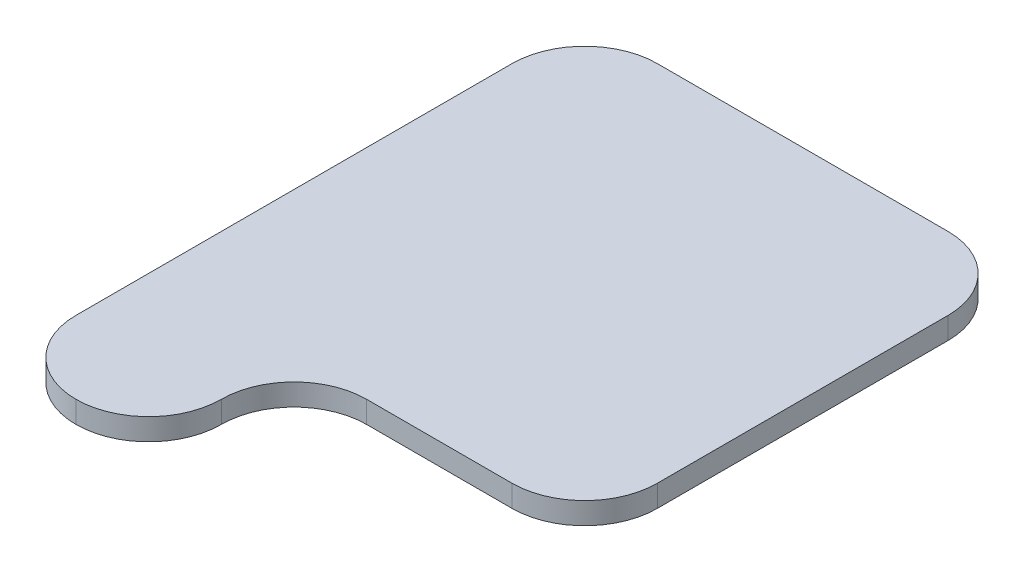
from build123d import *

# Parameters (mm, degrees)
SKETCH1_W           = 300
SKETCH1_H           = 300
SKETCH1_W_2         = 100
SKETCH1_H_2         = 100
BOSS_EXTRUDE1_DEPTH = 15
FILLET1_R           = 50


with BuildPart() as part:
    # Sketch1 → Boss-Extrude1 (new body)
    with BuildSketch(Plane(origin=(0, 0, 0), x_dir=(1, 0, 0), z_dir=(0, 1, 0))):
        with Locations((150, 150)):
            Rectangle(SKETCH1_W, SKETCH1_H)
        with Locations((50, -50)):
            Rectangle(SKETCH1_W_2, SKETCH1_H_2)
    extrude(amount=BOSS_EXTRUDE1_DEPTH)

    # Fillet1
    fillet1_edges = [part.edges().sort_by_distance(p)[0] for p in [
        (0, 7.5, -300),
        (0, 7.5, 100),
        (300, 7.5, -300),
        (300, 7.5, 0),
        (100, 7.5, 100),
        (100, 7.5, 0),
    ]]
    fillet(fillet1_edges, radius=FILLET1_R - 0.0001)  # a hair under: the kernel refuses the full size


solid = part.part
